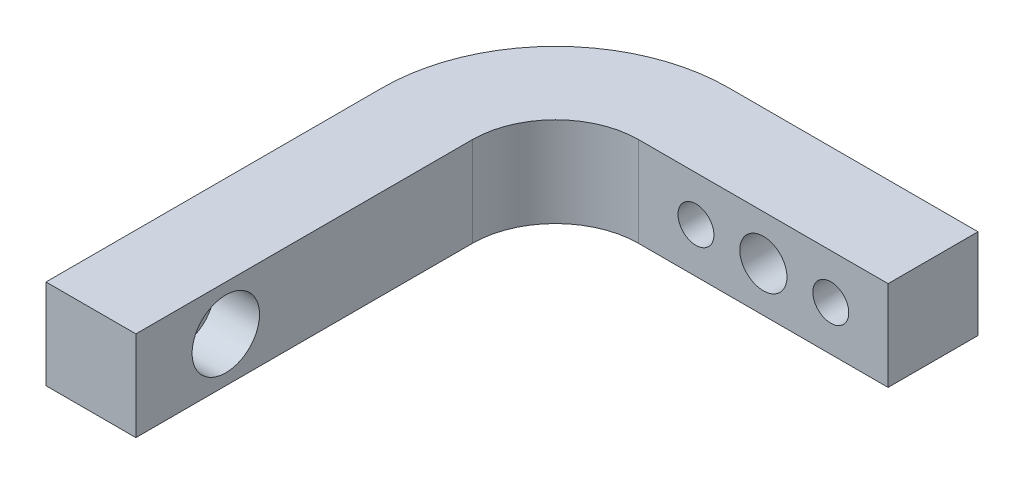
from build123d import *

# Parameters (mm, degrees)
BOSS_EXTRUDE1_DEPTH      = 4
BOSS_EXTRUDE1_DEPTH_BACK = 4
CUT_EXTRUDE1_DEPTH       = 55.294342247
CUT_EXTRUDE1_DEPTH_BACK  = 55.294342247
SKETCH2_R                = 1.75
SKETCH3_R                = 2.1
SKETCH3_R_2              = 1.6
CUT_EXTRUDE2_DEPTH       = 53.668449759
SKETCH4_R                = 3
CUT_EXTRUDE3_DEPTH       = 4


with BuildPart() as part:
    # Sketch1 → Boss-Extrude1 (new, two sides: drawn at the far end of the back side and taken through both)
    with BuildSketch(Plane(origin=(0, 0, 0), x_dir=(1, 0, 0), z_dir=(0, 1, 0)).offset(-BOSS_EXTRUDE1_DEPTH_BACK)):
        with BuildLine():
            Line((-11.1, 0), (11.1, 0))
            Line((11.1, 0), (11.1, -8))
            Line((11.1, -8), (-11.1, -8))
            ThreePointArc((-11.1, -8), (-16.332590181, -10.167409819), (-18.5, -15.4))
            Line((-18.5, -15.4), (-18.5, -45.34))
            Line((-18.5, -45.34), (-26.5, -45.34))
            Line((-26.5, -45.34), (-26.5, -15.4))
            ThreePointArc((-26.5, -15.4), (-21.98944443, -4.51055557), (-11.1, 0))
        make_face()
    extrude(amount=BOSS_EXTRUDE1_DEPTH + BOSS_EXTRUDE1_DEPTH_BACK)

    # Sketch2 → Cut-Extrude1 (cut, two sides: drawn at the far end of the back side and taken through both)
    with BuildSketch(Plane.ZY.offset(18.5).offset(-CUT_EXTRUDE1_DEPTH_BACK)):
        with Locations((37.34, 0)):
            Circle(SKETCH2_R)
    extrude(amount=CUT_EXTRUDE1_DEPTH + CUT_EXTRUDE1_DEPTH_BACK, mode=Mode.SUBTRACT)

    # Sketch3 → Cut-Extrude2 (cut, through all)
    with BuildSketch(Plane(origin=(0, 0, 0), x_dir=(-1, 0, 0), z_dir=(0, 0, -1))):
        Circle(SKETCH3_R)
        with Locations((-6, 0)):
            Circle(SKETCH3_R_2)
        with Locations((6, 0)):
            Circle(SKETCH3_R_2)
    extrude(amount=-CUT_EXTRUDE2_DEPTH, mode=Mode.SUBTRACT)

    # Sketch4 → Cut-Extrude3 (cut)
    with BuildSketch(Plane(origin=(-18.5, 0, 0), x_dir=(0, 0, -1), z_dir=(1, 0, 0))):
        with Locations((-37.34, 0)):
            Circle(SKETCH4_R)
    extrude(amount=-CUT_EXTRUDE3_DEPTH, mode=Mode.SUBTRACT)


solid = part.part
